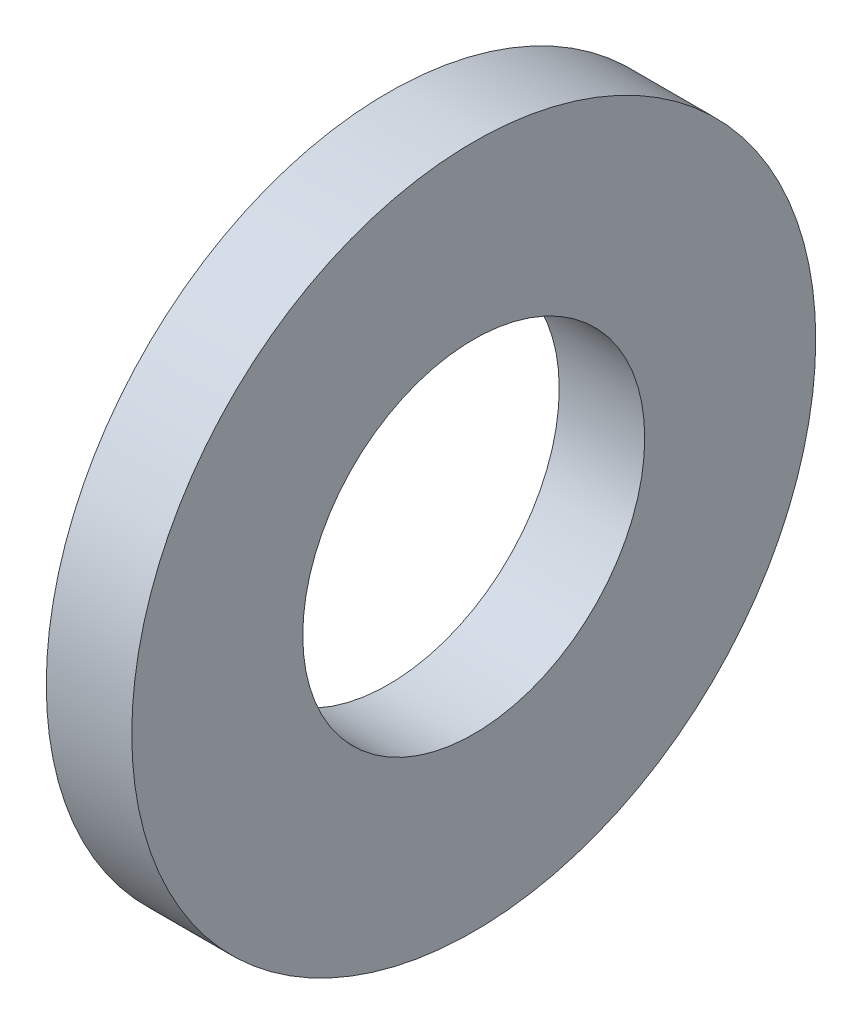
from build123d import *

# Parameters (mm, degrees)
ESQUISSE1_W = 1
ESQUISSE1_H = 2


with BuildPart() as part:
    # Esquisse1 → Base-Révolution (revolve)
    with BuildSketch(Plane(origin=(0, 0, 0), x_dir=(1, 0, 0), z_dir=(0, 1, 0))):
        with Locations((0.5, 3)):
            Rectangle(ESQUISSE1_W, ESQUISSE1_H)
    revolve(axis=Axis((0, 0, 0), (1, 0, 0)))


solid = part.part
